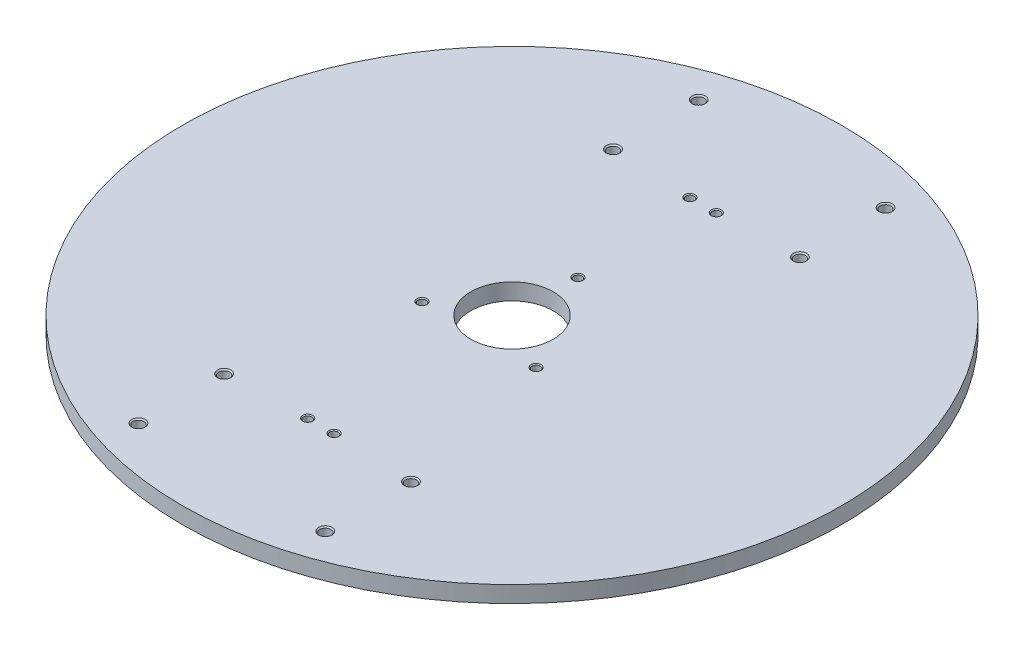
from build123d import *

# Parameters (mm, degrees)
SKETCH_1_R                   = 100
EXTRUDE_1_DEPTH              = 5
HOLE_WIZARD_M3_1_D           = 2.5
HOLE_WIZARD_M3_1_CSINK_D     = 3.05
HOLE_WIZARD_M3_1_CSINK_ANGLE = 90
SKETCH_5_R                   = 12.5
CUT_EXTRUDE_1_DEPTH          = 142.509716981
HOLE_WIZARD_M4_2_D           = 3.3
HOLE_WIZARD_M4_2_DEPTH       = 5
HOLE_WIZARD_M4_2_CSINK_D     = 4.05
HOLE_WIZARD_M4_2_CSINK_ANGLE = 90


# Read off the part's stored shape, not the designer's step: M3 螺纹孔2
with BuildPart() as part:
    # 草图1 → 凸台-拉伸1 (new body)
    with BuildSketch(Plane(origin=(0, 0, 0), x_dir=(1, 0, 0), z_dir=(0, 1, 0))):
        with Locations(Location((0, 0, 0), (0, 0, 270))):
            Circle(SKETCH_1_R)
    extrude(amount=EXTRUDE_1_DEPTH)

    # M3 螺纹孔1 (through all)
    with Locations(Plane(origin=(0, 5, 0), x_dir=(1, 0, 0), z_dir=(0, 1, 0))):
        with Locations((0, 20), (17.320508076, -10), (-17.320508076, -10)):
            CounterSinkHole(HOLE_WIZARD_M3_1_D / 2, HOLE_WIZARD_M3_1_CSINK_D / 2, counter_sink_angle=HOLE_WIZARD_M3_1_CSINK_ANGLE)

    # 草图5 → 切除-拉伸1 (cut, through all)
    with BuildSketch(Plane(origin=(0, 5, 0), x_dir=(1, 0, 0), z_dir=(0, 1, 0))):
        with Locations(Location((0, 0, 0), (0, 0, 270))):
            Circle(SKETCH_5_R)
    extrude(amount=-CUT_EXTRUDE_1_DEPTH, mode=Mode.SUBTRACT)

    # M4 螺纹孔2
    with Locations(Plane(origin=(0, 5, 0), x_dir=(1, 0, 0), z_dir=(0, 1, 0))):
        with Locations((0, 0), (-28.35, 85), (28.35, 85), (28.35, -85), (-28.35, -85), (-28.35, 59), (28.35, 59), (-28.35, -59), (28.35, -59)):
            CounterSinkHole(HOLE_WIZARD_M4_2_D / 2, HOLE_WIZARD_M4_2_CSINK_D / 2, depth=HOLE_WIZARD_M4_2_DEPTH, counter_sink_angle=HOLE_WIZARD_M4_2_CSINK_ANGLE)

    # M3 螺纹孔2 outline → M3 螺纹孔2 (revolve, cut)
    with BuildSketch(Plane(origin=(4, 0, 58), x_dir=(1, 0, 0), z_dir=(0, 0, 1))):
        Polygon((0, 0), (1.25, 0), (1.25, 4.725), (1.525, 5), (0, 5), align=None)
    revolve(axis=Axis((4, 0, 58), (0, 1, 0)), mode=Mode.SUBTRACT)

    # Hole Wizard M3 _2 2 outline → Hole Wizard M3 _2 2 (revolve, cut)
    with BuildSketch(Plane(origin=(-4, 0, 58), x_dir=(1, 0, 0), z_dir=(0, 0, 1))):
        Polygon((0, 0), (1.25, 0), (1.25, 4.725), (1.525, 5), (0, 5), align=None)
    revolve(axis=Axis((-4, 0, 58), (0, 1, 0)), mode=Mode.SUBTRACT)

    # Hole Wizard M3 _2 3 outline → Hole Wizard M3 _2 3 (revolve, cut)
    with BuildSketch(Plane(origin=(4, 0, -58), x_dir=(1, 0, 0), z_dir=(0, 0, 1))):
        Polygon((0, 0), (1.25, 0), (1.25, 4.725), (1.525, 5), (0, 5), align=None)
    revolve(axis=Axis((4, 0, -58), (0, 1, 0)), mode=Mode.SUBTRACT)

    # Hole Wizard M3 _2 4 outline → Hole Wizard M3 _2 4 (revolve, cut)
    with BuildSketch(Plane(origin=(-4, 0, -58), x_dir=(1, 0, 0), z_dir=(0, 0, 1))):
        Polygon((0, 0), (1.25, 0), (1.25, 4.725), (1.525, 5), (0, 5), align=None)
    revolve(axis=Axis((-4, 0, -58), (0, 1, 0)), mode=Mode.SUBTRACT)


solid = part.part
